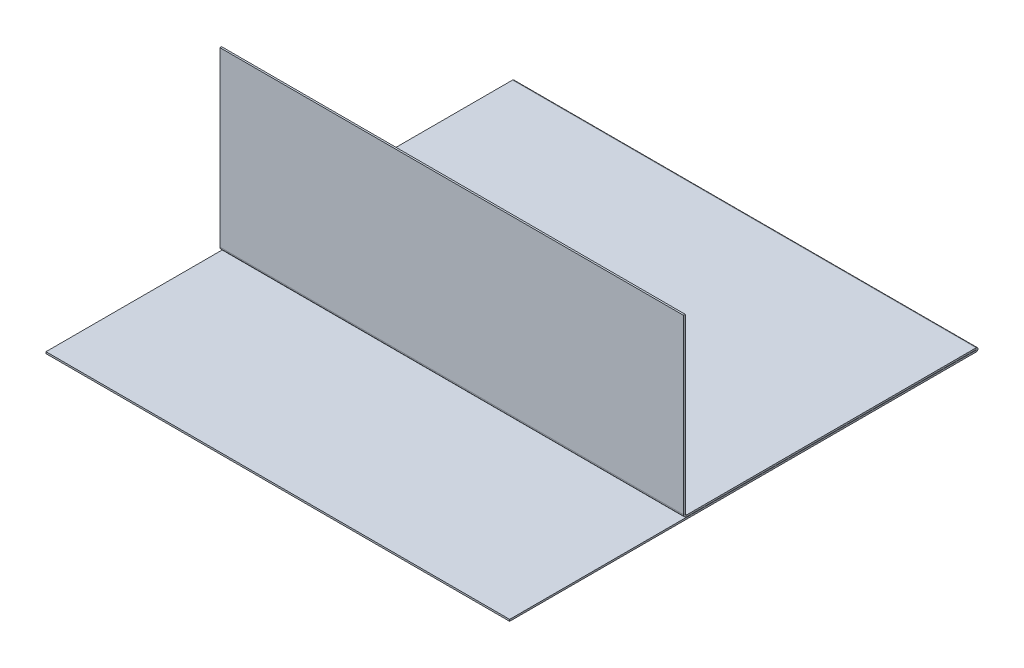
from build123d import *

# Parameters (mm, degrees)
SKETCH1_W                    = 198
SKETCH1_H                    = 125
BASE_FLANGE1_DEPTH           = 0.7366
EDGE_FLANGE1_STRIP_W         = 4.4196
EDGE_FLANGE1_STRIP_H         = 0.7366
EDGE_FLANGE1_STRIP_CUT_DEPTH = 198
EDGE_FLANGE1_DEPTH           = 198
HEM1_START                   = -99
HEM1_DEPTH                   = 198
HEM1_2_DEPTH                 = 198


with BuildPart() as part:
    # Base-Flange1: sheet metal written as solids
    # Sketch1 → Base-Flange1 (new body)
    with BuildSketch(Plane(origin=(0, 0, 0), x_dir=(1, 0, 0), z_dir=(0, 1, 0))):
        with Locations((0, 32.491501416)):
            Rectangle(SKETCH1_W, SKETCH1_H)
    extrude(amount=-BASE_FLANGE1_DEPTH)

    # Edge-Flange1: sheet metal written as solids
    # Edge-Flange1 strip (on a plane across the edge) → Edge-Flange1 strip cut (cut)
    with BuildSketch(Plane(origin=(-99, 0, 30.008498584), x_dir=(0, 0, -1), z_dir=(1, 0, 0))):
        with Locations((-1.4732, -0.3683)):
            Rectangle(EDGE_FLANGE1_STRIP_W, EDGE_FLANGE1_STRIP_H)
    extrude(amount=EDGE_FLANGE1_STRIP_CUT_DEPTH, mode=Mode.SUBTRACT)

    # Edge-Flange1 section (on a plane across the edge) → Edge-Flange1 (add)
    with BuildSketch(Plane(origin=(-99, 0, 30.008498584), x_dir=(0, 0, -1), z_dir=(1, 0, 0))):
        with BuildLine():
            Line((-0.7366, 0.7366), (-0.7366, 74.4732))
            Line((-0.7366, 74.4732), (0, 74.4732))
            Line((0, 74.4732), (0, 0.7366))
            ThreePointArc((0, 0.7366), (0.215745145, 0.215745145), (0.7366, 0))
            Line((0.7366, 0), (0.7366, -0.7366))
            ThreePointArc((0.7366, -0.7366), (-0.30510971, -0.30510971), (-0.7366, 0.7366))
        make_face()
    extrude(amount=EDGE_FLANGE1_DEPTH)

    # Hem1: read off the stored shape, not the designer's step
    # Hem1 outline → Hem1 (cut)
    with BuildSketch(Plane.YZ.offset(HEM1_START)):
        with BuildLine():
            ThreePointArc((0, -94.204901416), (-0.212984467, -94.743143722), (-0.7366, -94.98991069))
            Line((-0.7366, -94.98991069), (-0.7366, -94.991501416))
            Line((-0.7366, -94.991501416), (0, -94.991501416))
            Line((0, -94.991501416), (0, -94.204901416))
        make_face()
    extrude(amount=HEM1_DEPTH, mode=Mode.SUBTRACT)

    # Hem1 2 outline → Hem1 2 (add)
    with BuildSketch(Plane.YZ.offset(HEM1_START)):
        with BuildLine():
            Line((-0.8366, 105.008498584), (-1.5732, 105.008498584))
            Line((-1.5732, 105.008498584), (-1.5732, -94.204901416))
            ThreePointArc((-1.5732, -94.204901416), (-1.324842306, -94.778516949), (-0.7366, -94.98991069))
            Line((-0.7366, -94.98991069), (-0.7366, -94.204901416))
            ThreePointArc((-0.7366, -94.204901416), (-0.7866, -94.254901416), (-0.8366, -94.204901416))
            Line((-0.8366, -94.204901416), (-0.8366, 105.008498584))
        make_face()
    extrude(amount=HEM1_2_DEPTH)


solid = part.part
